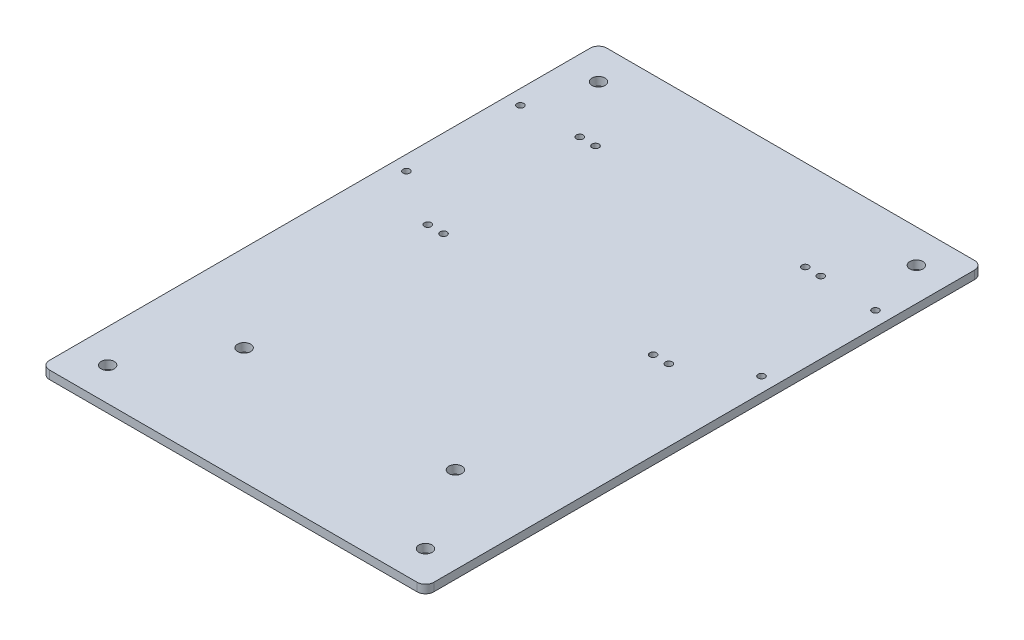
from build123d import *

# Parameters (mm, degrees)
SKETCH1_W           = 146.685
SKETCH1_H           = 212.725
SKETCH1_R           = 2.4892
BOSS_EXTRUDE1_DEPTH = 1.5875
FILLET1_R           = 3.175
SKETCH2_R           = 1.3
CUT_EXTRUDE1_DEPTH  = 130.236931012
SKETCH3_R           = 1.3
CUT_EXTRUDE2_DEPTH  = 130.236931012
SKETCH4_R           = 2.4892
CUT_EXTRUDE3_DEPTH  = 130.236931012


with BuildPart() as part:
    # Sketch1 → Boss-Extrude1 (new, symmetric)
    with BuildSketch(Plane(origin=(0, 0, 0), x_dir=(1, 0, 0), z_dir=(0, 1, 0))):
        Rectangle(SKETCH1_W, SKETCH1_H)
        with Locations((-60.6425, 93.6625)):
            Circle(SKETCH1_R, mode=Mode.SUBTRACT)
        with Locations((60.6425, 93.6625)):
            Circle(SKETCH1_R, mode=Mode.SUBTRACT)
        with Locations((60.6425, -93.6625)):
            Circle(SKETCH1_R, mode=Mode.SUBTRACT)
        with Locations((-60.6425, -93.6625)):
            Circle(SKETCH1_R, mode=Mode.SUBTRACT)
    extrude(amount=BOSS_EXTRUDE1_DEPTH, both=True)

    # Fillet1
    fillet1_edges = [part.edges().sort_by_distance(p)[0] for p in [
        (-73.3425, 0, 106.3625),
        (-73.3425, 0, -106.3625),
        (73.3425, 0, -106.3625),
        (73.3425, 0, 106.3625),
    ]]
    fillet(fillet1_edges, radius=FILLET1_R)

    # Sketch2 → Cut-Extrude1 (cut, through all)
    with BuildSketch(Plane(origin=(0, 1.5875, 0), x_dir=(1, 0, 0), z_dir=(0, 1, 0))):
        with Locations((-46, 71.8625)):
            Circle(SKETCH2_R)
        with Locations((-46, 13.8625)):
            Circle(SKETCH2_R)
        with Locations((46, 71.8625)):
            Circle(SKETCH2_R)
        with Locations((46, 13.8625)):
            Circle(SKETCH2_R)
        with Locations((-40, 71.8625)):
            Circle(SKETCH2_R)
        with Locations((-40, 13.8625)):
            Circle(SKETCH2_R)
        with Locations((40, 13.8625)):
            Circle(SKETCH2_R)
        with Locations((40, 71.8625)):
            Circle(SKETCH2_R)
    extrude(amount=-CUT_EXTRUDE1_DEPTH, mode=Mode.SUBTRACT)

    # Sketch3 → Cut-Extrude2 (cut, through all)
    with BuildSketch(Plane(origin=(0, 1.5875, 0), x_dir=(1, 0, 0), z_dir=(0, 1, 0))):
        with Locations((67.75, 70.962500061)):
            Circle(SKETCH3_R)
        with Locations((-67.75, 70.962500061)):
            Circle(SKETCH3_R)
        with Locations((-67.75, 27.462499939)):
            Circle(SKETCH3_R)
        with Locations((67.75, 27.462499939)):
            Circle(SKETCH3_R)
    extrude(amount=-CUT_EXTRUDE2_DEPTH, mode=Mode.SUBTRACT)

    # Sketch4 → Cut-Extrude3 (cut, through all)
    with BuildSketch(Plane(origin=(0, 1.5875, 0), x_dir=(1, 0, 0), z_dir=(0, 1, 0))):
        with Locations((-40.3225, -61.9125)):
            Circle(SKETCH4_R)
        with Locations((40.3225, -61.9125)):
            Circle(SKETCH4_R)
    extrude(amount=-CUT_EXTRUDE3_DEPTH, mode=Mode.SUBTRACT)


solid = part.part
